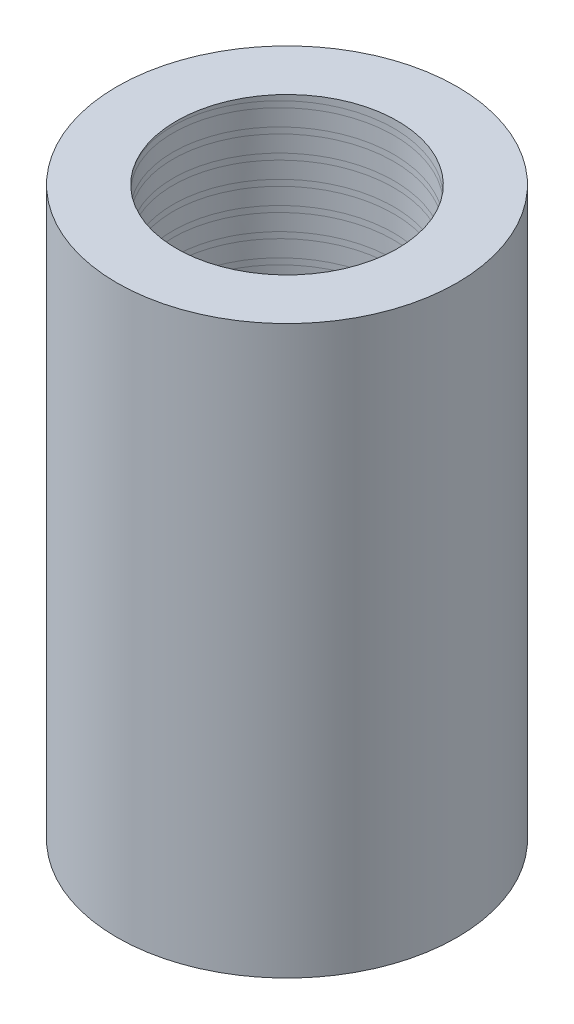
from build123d import *

# Parameters (mm, degrees)
SKETCH1_R              = 3
SKETCH1_R_2            = 1.75
BOSS_EXTRUDE1_DEPTH    = 5
CUT_SWEEP1_START       = -5
CUT_SWEEP1_OUTLINE_R   = 1.95
CUT_SWEEP1_OUTLINE_R_2 = 1.75
CUT_SWEEP1_DEPTH       = 10


# Read off the part's stored shape, not the designer's step: Cut-Sweep1
with BuildPart() as part:
    # Sketch1 → Boss-Extrude1 (new, symmetric)
    with BuildSketch(Plane(origin=(0, 0, 0), x_dir=(1, 0, 0), z_dir=(0, 1, 0))):
        with Locations(Location((0, 0, 0), (0, 0, 270))):
            Circle(SKETCH1_R)
        with Locations(Location((0, 0, 0), (0, 0, 270))):
            Circle(SKETCH1_R_2, mode=Mode.SUBTRACT)
    extrude(amount=BOSS_EXTRUDE1_DEPTH, both=True)

    # Cut-Sweep1 outline → Cut-Sweep1 (cut)
    with BuildSketch(Plane(origin=(0, 0, 0), x_dir=(1, 0, 0), z_dir=(0, 1, 0)).offset(CUT_SWEEP1_START)):
        Circle(CUT_SWEEP1_OUTLINE_R)
        Circle(CUT_SWEEP1_OUTLINE_R_2, mode=Mode.SUBTRACT)
    extrude(amount=CUT_SWEEP1_DEPTH, mode=Mode.SUBTRACT)


solid = part.part
